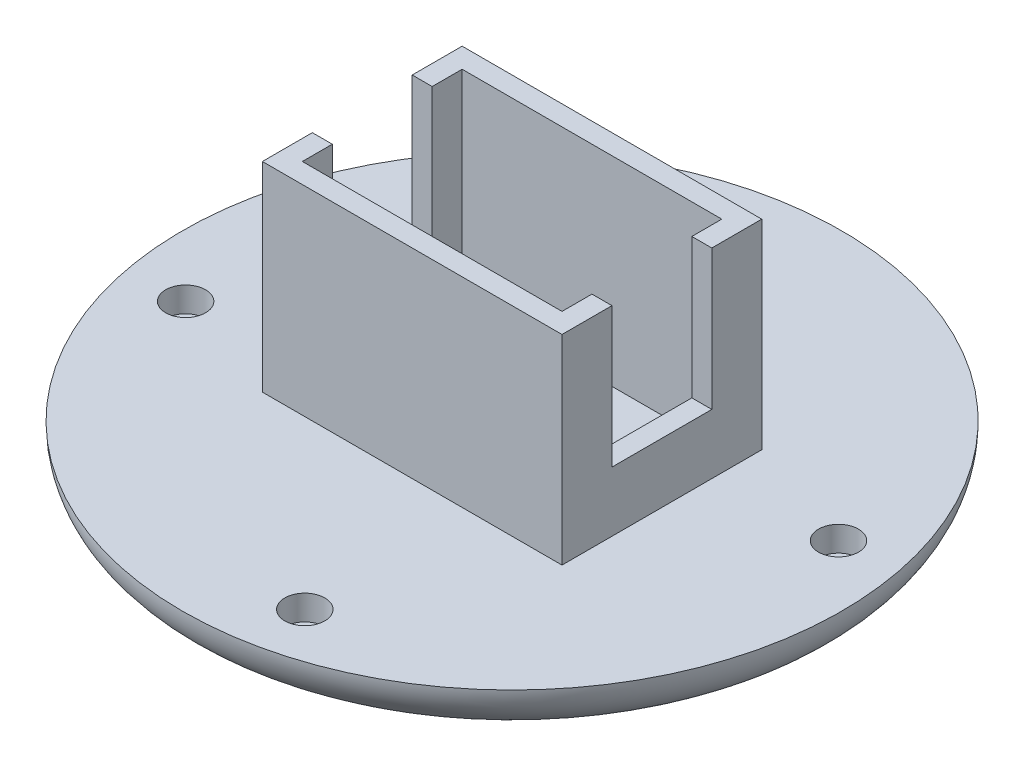
from build123d import *

# Parameters (mm, degrees)
SKETCH1_R           = 33
BOSS_EXTRUDE1_DEPTH = 5
SKETCH2_R           = 2
CUT_EXTRUDE1_DEPTH  = 2.5
FILLET1_R           = 5
SKETCH3_W           = 30
SKETCH3_H           = 20
SKETCH3_W_2         = 26
SKETCH3_H_2         = 16
BOSS_EXTRUDE2_DEPTH = 20
SKETCH4_W           = 10
SKETCH4_H           = 14
CUT_EXTRUDE2_DEPTH  = 60
CUT_EXTRUDE3_DEPTH  = 2


with BuildPart() as part:
    # Sketch1 → Boss-Extrude1 (new body)
    with BuildSketch(Plane(origin=(0, 0, 0), x_dir=(1, 0, 0), z_dir=(0, 1, 0))):
        with Locations(Location((0, 0, 0), (0, 0, 270))):
            Circle(SKETCH1_R)
    extrude(amount=BOSS_EXTRUDE1_DEPTH)

    # Sketch2 → Cut-Extrude1 (cut)
    with BuildSketch(Plane(origin=(0, 5, 0), x_dir=(1, 0, 0), z_dir=(0, 1, 0))):
        with Locations(Location((-26.719955328, -5.965376271, 0), (0, 0, 270))):
            Circle(SKETCH2_R)
        with Locations(Location((-5.965376271, 26.719955328, 0), (0, 0, 270))):
            Circle(SKETCH2_R)
        with Locations(Location((26.719955328, 5.965376271, 0), (0, 0, 270))):
            Circle(SKETCH2_R)
        with Locations(Location((5.965376271, -26.719955328, 0), (0, 0, 270))):
            Circle(SKETCH2_R)
    extrude(amount=-CUT_EXTRUDE1_DEPTH, mode=Mode.SUBTRACT)

    # Fillet1
    fillet1_edges = [part.edges().sort_by_distance(p)[0] for p in [
        (0, 0, -33),
    ]]
    fillet(fillet1_edges, radius=FILLET1_R - 0.0001)  # a hair under: the kernel refuses the full size

    # Sketch3 → Boss-Extrude2 (add)
    with BuildSketch(Plane(origin=(0, 5, 0), x_dir=(1, 0, 0), z_dir=(0, 1, 0))):
        Rectangle(SKETCH3_W, SKETCH3_H)
        Rectangle(SKETCH3_W_2, SKETCH3_H_2, mode=Mode.SUBTRACT)
    extrude(amount=BOSS_EXTRUDE2_DEPTH)

    # Sketch4 → Cut-Extrude2 (cut)
    with BuildSketch(Plane(origin=(15, 0, 0), x_dir=(0, 0, -1), z_dir=(1, 0, 0))):
        with Locations((0, 18)):
            Rectangle(SKETCH4_W, SKETCH4_H)
    extrude(amount=-CUT_EXTRUDE2_DEPTH, mode=Mode.SUBTRACT)

    # Sketch5 → Cut-Extrude3 (cut)
    # profile 1 of 6: a face of its own
    with BuildSketch(Plane.XZ):
        with BuildLine():
            Line((1.664262821, 12.558994391), (-1.319611378, 11.847956731))
            add(Edge.make_bspline(
                [(-1.319611378, 11.847956731), (-1.519248613, 11.800876622), (-1.901467304, 11.71073864), (-2.452058145, 11.589306946), (-2.953991864, 11.486166859), (-3.407768687, 11.403650904), (-3.81068833, 11.331809329), (-4.166380691, 11.287494536), (-4.472511138, 11.251564271), (-4.661511051, 11.24746012), (-4.747495994, 11.245592949)],
                knots=[0, 0, 0, 0, 1.412251824, 2.703849526, 3.882006687, 4.94007724, 5.879658689, 6.699050707, 7.408137027, 8, 8, 8, 8], degree=3))
            add(Edge.make_bspline(
                [(-4.747495994, 11.245592949), (-4.863488733, 11.246938304), (-5.091869962, 11.249587211), (-5.429633266, 11.283899607), (-5.75642484, 11.346845645), (-6.073393568, 11.433161597), (-6.379615937, 11.545890967), (-6.675311549, 11.683303575), (-6.962482238, 11.84396484), (-7.233801146, 12.034590453), (-7.492620459, 12.24283844), (-7.72462604, 12.479440772), (-7.942052223, 12.728592239), (-8.127229025, 13.006673068), (-8.296123908, 13.300045608), (-8.438555549, 13.616762802), (-8.561049573, 13.952854841), (-8.622317455, 14.187495225), (-8.653545673, 14.307091346)],
                knots=[0, 0, 0, 0, 1.032722796, 2.033355729, 3.018586808, 3.993545528, 4.955873807, 5.920891082, 6.89497798, 7.881932246, 8.870950372, 9.848606801, 10.82938674, 11.811119103, 12.818353036, 13.841322028, 14.899722601, 16, 16, 16, 16], degree=3))
            add(Edge.make_bspline(
                [(-8.653545673, 14.307091346), (-8.694425706, 14.507107456), (-8.774154646, 14.897201872), (-8.795951361, 15.484892283), (-8.746494369, 16.053184804), (-8.607624084, 16.59805325), (-8.394710468, 17.113999499), (-8.098002423, 17.586761348), (-7.728973327, 18.01782168), (-7.362278557, 18.338263206), (-7.025693342, 18.570173549), (-6.742689691, 18.742376396), (-6.427686986, 18.901437318), (-6.087270604, 19.058394271), (-5.715485412, 19.198762111), (-5.317629711, 19.337013713), (-4.889047435, 19.462815928), (-4.592464721, 19.539785892), (-4.440104167, 19.579326923)],
                knots=[0, 0, 0, 0, 1.275125421, 2.48689622, 3.663872066, 4.832108336, 5.989983623, 7.141524783, 8.307911852, 9.52841957, 10.174958571, 10.863351355, 11.598814344, 12.381087174, 13.207066163, 14.083349499, 15.015377774, 16, 16, 16, 16], degree=3))
            Line((-4.440104167, 19.579326923), (-11.491486378, 25.261418269))
            Line((-11.491486378, 25.261418269), (-9.637820513, 25.702323718))
            Line((-9.637820513, 25.702323718), (-2.598858173, 20.017127404))
            Line((-2.598858173, 20.017127404), (-1.741887019, 20.222055288))
            Line((-1.741887019, 20.222055288), (-3.403044872, 27.189603365))
            Line((-3.403044872, 27.189603365), (-1.906450321, 27.546674679))
            Line((-1.906450321, 27.546674679), (1.664262821, 12.558994391))
        make_face()
        with BuildLine():
            Line((-0.180088141, 13.670572917), (-1.394130609, 18.762720353))
            Line((-1.394130609, 18.762720353), (-3.977463942, 18.169671474))
            add(Edge.make_bspline(
                [(-3.977463942, 18.169671474), (-4.097647698, 18.140175611), (-4.330496001, 18.083029273), (-4.665881832, 17.991750771), (-4.973108406, 17.89016769), (-5.256024725, 17.793156511), (-5.511469233, 17.689528295), (-5.742409508, 17.586427561), (-5.943750678, 17.472861443), (-6.178694317, 17.32743165), (-6.429775905, 17.121544728), (-6.684092224, 16.840466321), (-6.886774128, 16.524388988), (-7.038267299, 16.179394673), (-7.138056843, 15.816291284), (-7.181761237, 15.441674197), (-7.170161919, 15.05947404), (-7.120203772, 14.807536814), (-7.094851763, 14.6796875)],
                knots=[0, 0, 0, 0, 1.113007475, 2.156380457, 3.124858045, 4.022770118, 4.84555165, 5.603601701, 6.295248698, 6.922790364, 8.087272401, 9.201213672, 10.319231134, 11.448660379, 12.577744345, 13.693084846, 14.829321399, 16, 16, 16, 16], degree=3))
            add(Edge.make_bspline(
                [(-7.094851763, 14.6796875), (-7.059976799, 14.557400234), (-6.991414375, 14.316989618), (-6.829951093, 13.978923594), (-6.618722541, 13.673762491), (-6.369827872, 13.396604775), (-6.081320959, 13.166879121), (-5.770921604, 12.978180782), (-5.435484949, 12.848223676), (-5.13733809, 12.781682869), (-4.880403928, 12.757386608), (-4.660462398, 12.756279323), (-4.415836954, 12.765012029), (-4.145444012, 12.790920168), (-3.84928671, 12.831842806), (-3.528619848, 12.888534929), (-3.18151293, 12.95654007), (-2.943352973, 13.011591634), (-2.819310897, 13.040264423)],
                knots=[0, 0, 0, 0, 1.166588228, 2.293453786, 3.422042412, 4.566100866, 5.701913746, 6.797548201, 7.890333038, 8.990577245, 9.592215168, 10.257758435, 11.009336249, 11.83991645, 12.751478409, 13.754884051, 14.830664716, 16, 16, 16, 16], degree=3))
            Line((-2.819310897, 13.040264423), (-0.180088141, 13.670572917))
        make_face(mode=Mode.SUBTRACT)
    # profile 2 of 6: a face of its own
    with BuildSketch(Plane.XZ):
        Polygon((-8.382478089, 9.634353695), (-9.012786583, 8.215383342), (-14.940170397, 10.854606099), (-18.141392352, 3.666605297), (-12.214008538, 1.027382541), (-12.844317031, -0.391587812), (-26.975026166, 5.899077253), (-26.344717672, 7.318047605), (-19.523103089, 4.281388951), (-16.321881134, 11.469389753), (-23.143495717, 14.506048406), (-22.513187224, 15.925018759), align=None)
    # profile 3 of 6: a face of its own
    with BuildSketch(Plane.XZ):
        with BuildLine():
            add(Edge.make_bspline(
                [(-8.788963696, -6.044403265), (-8.633131373, -6.283800211), (-8.326704646, -6.754547363), (-7.955056629, -7.497634693), (-7.659968234, -8.250873067), (-7.443304253, -9.015884205), (-7.313843428, -9.794840285), (-7.259829088, -10.584230191), (-7.289015477, -11.386292396), (-7.398077061, -12.19072439), (-7.579130449, -12.979914451), (-7.830648255, -13.736954323), (-8.155754525, -14.451093587), (-8.547941529, -15.124879978), (-9.011033186, -15.756672433), (-9.544919299, -16.344034019), (-10.146673333, -16.893209621), (-10.592645028, -17.214183515), (-10.819612735, -17.377536278)],
                knots=[0, 0, 0, 0, 1.066347916, 2.096853169, 3.096979218, 4.084773711, 5.061061122, 6.041420347, 7.03564784, 8.053763729, 9.069461609, 10.056105373, 11.028496088, 11.99529837, 12.963460257, 13.948868523, 14.956120734, 16, 16, 16, 16], degree=3))
            add(Edge.make_bspline(
                [(-10.819612735, -17.377536278), (-11.051843956, -17.528080673), (-11.509490836, -17.824751262), (-12.233378509, -18.184230154), (-12.97134679, -18.467229588), (-13.724897493, -18.669246066), (-14.494612419, -18.794433153), (-15.27909895, -18.841498099), (-16.078730956, -18.804970577), (-16.882257454, -18.694156909), (-17.672389483, -18.509348436), (-18.429932948, -18.254995976), (-19.145260283, -17.931234663), (-19.815615667, -17.536366546), (-20.448035844, -17.079271907), (-21.031169195, -16.546971598), (-21.578510034, -15.951778537), (-21.897330568, -15.509757737), (-22.059596709, -15.28478788)],
                knots=[0, 0, 0, 0, 1.042650877, 2.054701852, 3.040200699, 4.017890713, 4.990326957, 5.975308172, 6.975077741, 8.003075852, 9.028991185, 10.02964354, 11.010970413, 11.983289235, 12.958047498, 13.947000568, 14.955110288, 16, 16, 16, 16], degree=3))
            add(Edge.make_bspline(
                [(-22.059596709, -15.28478788), (-22.212391792, -15.049545216), (-22.512785782, -14.587059897), (-22.8749492, -13.854830963), (-23.164817953, -13.111569316), (-23.373037668, -12.353040607), (-23.502138177, -11.579989486), (-23.547136159, -10.794316982), (-23.516141835, -9.994547222), (-23.404008082, -9.19105917), (-23.218867944, -8.401448071), (-22.968094053, -7.645138052), (-22.651399609, -6.930354702), (-22.258149446, -6.265166326), (-21.80930457, -5.634685822), (-21.280651362, -5.057867507), (-20.695457365, -4.515002699), (-20.259170572, -4.200794214), (-20.038262574, -4.041698938)],
                knots=[0, 0, 0, 0, 1.057586695, 2.079207535, 3.0756129, 4.06369646, 5.041424374, 6.027221237, 7.027658669, 8.056508049, 9.083272926, 10.08351219, 11.058882231, 12.026663742, 12.994484645, 13.97322579, 14.973769912, 16, 16, 16, 16], degree=3))
            add(Edge.make_bspline(
                [(-20.038262574, -4.041698938), (-19.885177479, -3.941555656), (-19.581222075, -3.742717933), (-19.107776248, -3.47813605), (-18.623120582, -3.248532825), (-18.127690085, -3.051319789), (-17.6207123, -2.891152659), (-17.104801956, -2.759419259), (-16.577804625, -2.663131706), (-16.042548031, -2.601260908), (-15.505376045, -2.574885972), (-14.973279954, -2.575305729), (-14.448461451, -2.617356548), (-13.93088869, -2.6914541), (-13.419778649, -2.799061529), (-12.919120622, -2.948010409), (-12.423055607, -3.123594325), (-11.938185448, -3.337887321), (-11.468054559, -3.582775044), (-11.015914325, -3.852841279), (-10.587646267, -4.150868411), (-10.181811788, -4.476372173), (-9.796093475, -4.826025167), (-9.436451767, -5.206024587), (-9.098275806, -5.611617182), (-8.892750077, -5.899186509), (-8.788963696, -6.044403265)],
                knots=[0, 0, 0, 0, 1.036002277, 2.057015997, 3.069290012, 4.071977205, 5.075058539, 6.078944811, 7.086283282, 8.107297002, 9.128781918, 10.131331981, 11.119221036, 12.10836186, 13.091507624, 14.074810702, 15.065080236, 16.070506081, 17.074820249, 18.066199874, 19.051772451, 20.027812884, 21.011378094, 21.998344693, 22.989204118, 24, 24, 24, 24], degree=3))
        make_face()
        with BuildLine():
            add(Edge.make_bspline(
                [(-9.990586292, -6.954158874), (-10.072802838, -6.839066265), (-10.236164956, -6.610380276), (-10.509048646, -6.290501402), (-10.79819613, -5.987599679), (-11.108663592, -5.704379811), (-11.441137322, -5.444918471), (-11.791307062, -5.203861303), (-12.160977779, -4.982843037), (-12.549716693, -4.786343178), (-12.950211516, -4.613060086), (-13.355552565, -4.462198723), (-13.767489295, -4.346155152), (-14.180313492, -4.250368262), (-14.598867971, -4.18926807), (-15.020988604, -4.154908681), (-15.448342061, -4.148914597), (-15.877724234, -4.170561139), (-16.306147855, -4.220001679), (-16.730298841, -4.298237439), (-17.148443382, -4.403370566), (-17.560926876, -4.536748864), (-17.963785856, -4.703565498), (-18.363615294, -4.891945225), (-18.754321449, -5.113334268), (-19.007224681, -5.278199394), (-19.134716901, -5.361310316)],
                knots=[0, 0, 0, 0, 0.986346068, 1.959843726, 2.930122845, 3.906374618, 4.888589265, 5.869954291, 6.870495761, 7.890900906, 8.906312384, 9.913682505, 10.905484083, 11.889925495, 12.868177814, 13.853360363, 14.84266194, 15.847570791, 16.850662212, 17.849091154, 18.854285303, 19.856674834, 20.870339144, 21.894136256, 22.938403269, 24, 24, 24, 24], degree=3))
            add(Edge.make_bspline(
                [(-19.134716901, -5.361310316), (-19.316510856, -5.492389947), (-19.675520433, -5.751248075), (-20.159014173, -6.194075576), (-20.587947787, -6.66955646), (-20.96365053, -7.176262039), (-21.277633027, -7.721502042), (-21.540322273, -8.298027493), (-21.745353934, -8.910024874), (-21.891967351, -9.547656704), (-21.982147212, -10.194020832), (-22.010698079, -10.835437039), (-21.978577231, -11.464214476), (-21.875954085, -12.079236846), (-21.720099206, -12.682195727), (-21.490440089, -13.268050425), (-21.2118849, -13.847052905), (-20.974975402, -14.209773326), (-20.854869145, -14.393662079)],
                knots=[0, 0, 0, 0, 1.050408871, 2.074364045, 3.067635552, 4.050126643, 5.026700508, 6.01292559, 7.016803085, 8.048243737, 9.077260157, 10.073291333, 11.055254693, 12.024028632, 12.993009276, 13.970198176, 14.970949235, 16, 16, 16, 16], degree=3))
            add(Edge.make_bspline(
                [(-20.854869145, -14.393662079), (-20.769338261, -14.51374253), (-20.598911444, -14.753011998), (-20.31978534, -15.091009545), (-20.020388027, -15.405782193), (-19.703165443, -15.697218309), (-19.371436485, -15.968395686), (-19.02000174, -16.215135463), (-18.652497631, -16.441335382), (-18.267205846, -16.642768283), (-17.871868454, -16.818423949), (-17.470364195, -16.969546959), (-17.062950905, -17.086751348), (-16.651961044, -17.176148967), (-16.237671885, -17.243484092), (-15.817193945, -17.27753753), (-15.391910395, -17.278712535), (-14.963659927, -17.257817972), (-14.535784931, -17.209600162), (-14.113511484, -17.126198228), (-13.696129406, -17.02362629), (-13.288289499, -16.883005918), (-12.884533748, -16.723910031), (-12.487650897, -16.532131707), (-12.097767719, -16.313132505), (-11.846406997, -16.147429916), (-11.72005344, -16.064134835)],
                knots=[0, 0, 0, 0, 1.024383268, 2.041161883, 3.043487566, 4.041234329, 5.03320816, 6.019086654, 7.023294738, 8.030358359, 9.038243696, 10.028311865, 11.009455591, 11.981592946, 12.950131015, 13.924421561, 14.90990636, 15.903834256, 16.903135546, 17.899117578, 18.893539895, 19.8875719, 20.894712585, 21.908152602, 22.948473905, 24, 24, 24, 24], degree=3))
            add(Edge.make_bspline(
                [(-11.72005344, -16.064134835), (-11.596760027, -15.976674361), (-11.352918891, -15.803701118), (-11.011097557, -15.519840757), (-10.693668401, -15.220352225), (-10.397532889, -14.908388446), (-10.130321797, -14.57639936), (-9.883511001, -14.230781575), (-9.660487031, -13.869270688), (-9.464673202, -13.491959487), (-9.294617558, -13.103713121), (-9.146866693, -12.707582744), (-9.034134311, -12.301752778), (-8.940848634, -11.890988664), (-8.884706183, -11.471084852), (-8.849009095, -11.044124853), (-8.843236577, -10.609450922), (-8.866091579, -10.169998649), (-8.910728007, -9.732095332), (-8.985775493, -9.301617245), (-9.088356041, -8.882794663), (-9.216638208, -8.474500315), (-9.367333791, -8.076033337), (-9.550085832, -7.690731005), (-9.752580936, -7.31294428), (-9.911032655, -7.074083419), (-9.990586292, -6.954158874)],
                knots=[0, 0, 0, 0, 1.054538089, 2.085592097, 3.09721388, 4.098626683, 5.084448461, 6.068416642, 7.060593608, 8.045833203, 9.032131058, 10.016920548, 10.993091901, 11.969156381, 12.953760474, 13.946384195, 14.957593408, 15.984389148, 17.015645493, 18.027267275, 19.030969262, 20.022331039, 21.012192168, 22.000866966, 22.996298013, 24, 24, 24, 24], degree=3))
        make_face(mode=Mode.SUBTRACT)
    # profile 4 of 6: a face of its own
    with BuildSketch(Plane.XZ):
        with BuildLine():
            Line((9.020958739, -13.233530669), (7.893855374, -14.283009836))
            add(Edge.make_bspline(
                [(7.893855374, -14.283009836), (7.798527589, -14.184789792), (7.60931407, -13.989835507), (7.311011018, -13.715691399), (7.000226116, -13.464735158), (6.679660375, -13.233335192), (6.34726862, -13.025733815), (6.003787729, -12.838703946), (5.650628128, -12.670999436), (5.286672662, -12.52474777), (4.915134278, -12.401591401), (4.5370681, -12.297681331), (4.152239498, -12.217898971), (3.75960955, -12.15705695), (3.3600813, -12.125895156), (2.953987089, -12.107755997), (2.541430672, -12.118742594), (2.264473061, -12.139453806), (2.124824925, -12.149896855)],
                knots=[0, 0, 0, 0, 1.029192983, 2.042817069, 3.044446961, 4.03157737, 5.014186758, 5.989431965, 6.97123955, 7.952615125, 8.93713387, 9.913310394, 10.899427685, 11.891211218, 12.898901143, 13.911478792, 14.946921546, 16, 16, 16, 16], degree=3))
            add(Edge.make_bspline(
                [(2.124824925, -12.149896855), (1.972422137, -12.167755584), (1.670388769, -12.203148193), (1.22526968, -12.287523217), (0.791641027, -12.39943498), (0.3692786, -12.540545978), (-0.043859729, -12.70308046), (-0.443569759, -12.89778496), (-0.831493792, -13.119142164), (-1.208845115, -13.362383817), (-1.567090707, -13.62862957), (-1.90432772, -13.91140924), (-2.215807175, -14.213217218), (-2.50138272, -14.534323248), (-2.765474691, -14.87043698), (-3.010242516, -15.220558007), (-3.222496686, -15.59261795), (-3.416508816, -15.975830992), (-3.580038483, -16.375229958), (-3.720704588, -16.783006381), (-3.829402078, -17.201594297), (-3.909019947, -17.628183092), (-3.967073561, -18.063344767), (-3.989920426, -18.508542911), (-3.988338315, -18.962816984), (-3.963936101, -19.267614032), (-3.95159735, -19.421731791)],
                knots=[0, 0, 0, 0, 1.044826376, 2.070647343, 3.082790247, 4.092573954, 5.101791619, 6.104340535, 7.117685495, 8.142222049, 9.160116993, 10.155628122, 11.137671518, 12.111177453, 13.079976231, 14.047851367, 15.017496045, 15.994746297, 16.971309893, 17.954364714, 18.930622975, 19.9135767, 20.908563607, 21.918150466, 22.947332371, 24, 24, 24, 24], degree=3))
            add(Edge.make_bspline(
                [(-3.95159735, -19.421731791), (-3.924132717, -19.65124563), (-3.87010103, -20.10277249), (-3.710849604, -20.757165532), (-3.50115106, -21.37915577), (-3.229546166, -21.964675659), (-2.901699723, -22.51586938), (-2.513831246, -23.029614124), (-2.070385216, -23.510802821), (-1.573365623, -23.950645194), (-1.035905353, -24.344301332), (-0.466294226, -24.678594379), (0.132119863, -24.946545964), (0.754783298, -25.155691436), (1.40406187, -25.301836069), (2.078841529, -25.384661052), (2.779616104, -25.408309202), (3.253107921, -25.373197458), (3.494115791, -25.355325541)],
                knots=[0, 0, 0, 0, 1.041047245, 2.048071672, 3.029098689, 3.995464341, 4.951506101, 5.914352352, 6.891545373, 7.89608158, 8.900996827, 9.889900334, 10.867059949, 11.851010717, 12.8457834, 13.861254316, 14.911376035, 16, 16, 16, 16], degree=3))
            add(Edge.make_bspline(
                [(3.494115791, -25.355325541), (3.758079892, -25.323049775), (4.277952428, -25.259483236), (5.02984905, -25.061476176), (5.74297849, -24.796544438), (6.411747378, -24.446427568), (7.043603872, -24.02733424), (7.628177245, -23.523306731), (8.181203023, -22.952640965), (8.500977647, -22.520296019), (8.663887425, -22.300037079)],
                knots=[0, 0, 0, 0, 1.027151908, 2.022957153, 2.998084864, 3.962786458, 4.935027868, 5.922913979, 6.941824653, 8, 8, 8, 8], degree=3))
            Line((8.663887425, -22.300037079), (9.971078932, -23.104223778))
            add(Edge.make_bspline(
                [(9.971078932, -23.104223778), (9.884562558, -23.233588151), (9.712291103, -23.49117857), (9.429309315, -23.857407949), (9.125575982, -24.203745616), (8.804496771, -24.533995562), (8.457006764, -24.8390698), (8.098187972, -25.134229048), (7.71392016, -25.4037954), (7.31172542, -25.654639861), (6.89167206, -25.884287038), (6.458459302, -26.09316477), (6.007547418, -26.27353733), (5.542763452, -26.43038519), (5.064050302, -26.56973705), (4.568506819, -26.675569955), (4.059230099, -26.765171268), (3.712773014, -26.802164572), (3.537585342, -26.820870413)],
                knots=[0, 0, 0, 0, 0.970114284, 1.931692155, 2.882929594, 3.841188939, 4.800967988, 5.764427767, 6.736621612, 7.72502069, 8.718462438, 9.720002803, 10.721771814, 11.744133542, 12.77765545, 13.828240384, 14.901839424, 16, 16, 16, 16], degree=3))
            add(Edge.make_bspline(
                [(3.537585342, -26.820870413), (3.371044013, -26.834820899), (3.042466151, -26.862344523), (2.553422189, -26.876660038), (2.075630252, -26.87261519), (1.608657404, -26.838839098), (1.153078333, -26.7926244), (0.709052063, -26.715143076), (0.275740172, -26.622154173), (-0.14459685, -26.497488203), (-0.555704928, -26.360441733), (-0.953118438, -26.194499203), (-1.339461656, -26.007386726), (-1.715293459, -25.799970054), (-2.079382352, -25.568590154), (-2.434340515, -25.317709232), (-2.776176824, -25.041301094), (-2.992232886, -24.841150203), (-3.100836132, -24.740541887)],
                knots=[0, 0, 0, 0, 1.115579436, 2.200983431, 3.265197456, 4.303982899, 5.32573697, 6.320858246, 7.311675936, 8.282657987, 9.246310091, 10.203599088, 11.155461049, 12.111177629, 13.067768094, 14.034092066, 15.01181211, 16, 16, 16, 16], degree=3))
            add(Edge.make_bspline(
                [(-3.100836132, -24.740541887), (-3.27632612, -24.564825594), (-3.624767652, -24.215934722), (-4.08048148, -23.635479261), (-4.482908208, -23.024873765), (-4.82271459, -22.376065475), (-5.107344317, -21.693952976), (-5.328195066, -20.973772703), (-5.500971464, -20.220764363), (-5.560714321, -19.703007255), (-5.591020427, -19.440361599)],
                knots=[0, 0, 0, 0, 0.994951044, 1.975510236, 2.952691698, 3.923508241, 4.90764357, 5.911725957, 6.940669092, 8, 8, 8, 8], degree=3))
            add(Edge.make_bspline(
                [(-5.591020427, -19.440361599), (-5.611410227, -19.163116594), (-5.651575269, -18.616982867), (-5.609380536, -17.806614665), (-5.499799497, -17.022098291), (-5.309603643, -16.2642156), (-5.040593898, -15.532738802), (-4.693762204, -14.829099492), (-4.271620772, -14.15013544), (-3.774692829, -13.507942868), (-3.218497302, -12.910283016), (-2.612485035, -12.373800428), (-1.959209265, -11.908905961), (-1.262618719, -11.511743262), (-0.520290313, -11.185350213), (0.266023647, -10.928184628), (1.095243363, -10.735526248), (1.666494176, -10.666625462), (1.957156656, -10.631567528)],
                knots=[0, 0, 0, 0, 1.029324942, 2.027625598, 3.000196547, 3.961149227, 4.917359692, 5.883099852, 6.86333231, 7.87523045, 8.887470184, 9.884775638, 10.869261142, 11.853567311, 12.851315199, 13.868947012, 14.915682685, 16, 16, 16, 16], degree=3))
            add(Edge.make_bspline(
                [(1.957156656, -10.631567528), (2.135070167, -10.61709286), (2.487397621, -10.588428241), (3.012923719, -10.581754806), (3.528210076, -10.594342769), (4.032002524, -10.642162833), (4.524484321, -10.716475605), (5.006572639, -10.819255467), (5.478649317, -10.949013951), (5.938299467, -11.108583633), (6.384995221, -11.290066122), (6.814119579, -11.499882819), (7.227268215, -11.728955557), (7.623298785, -11.980634047), (8.00016948, -12.258513401), (8.359443299, -12.559720104), (8.703846356, -12.882264242), (8.914917081, -13.116067976), (9.020958739, -13.233530669)],
                knots=[0, 0, 0, 0, 1.094618293, 2.167705397, 3.222055536, 4.254932573, 5.269521929, 6.275614172, 7.276766784, 8.270585586, 9.258547098, 10.232456376, 11.198720839, 12.15502733, 13.108632622, 14.068619858, 15.029677114, 16, 16, 16, 16], degree=3))
        make_face()
    # profile 5 of 6: a face of its own
    with BuildSketch(Plane.XZ):
        Polygon((10.425049266, -4.747417012), (27.446483561, -5.101383358), (26.713711125, -6.588663005), (21.09061417, -6.52035371), (18.156419458, -12.488102108), (21.646403433, -16.894051627), (20.885686285, -18.437220698), (10.257380997, -5.085858518), align=None)
        Polygon((13.278514811, -6.362000345), (17.122465131, -11.208855313), (19.451191093, -6.473779191), align=None, mode=Mode.SUBTRACT)
    # profile 6 of 6: a face of its own
    with BuildSketch(Plane.XZ):
        Polygon((26.183196273, 8.512011673), (12.909458292, 0.69059741), (12.738685055, 0.979359429), (17.700423837, 15.790056545), (7.540968709, 9.80367834), (6.76783169, 11.113974814), (20.041569671, 18.935389077), (20.218552844, 18.637312154), (15.337543228, 3.972548532), (25.372799639, 9.884407506), align=None)
    extrude(amount=-CUT_EXTRUDE3_DEPTH, mode=Mode.SUBTRACT)


solid = part.part
